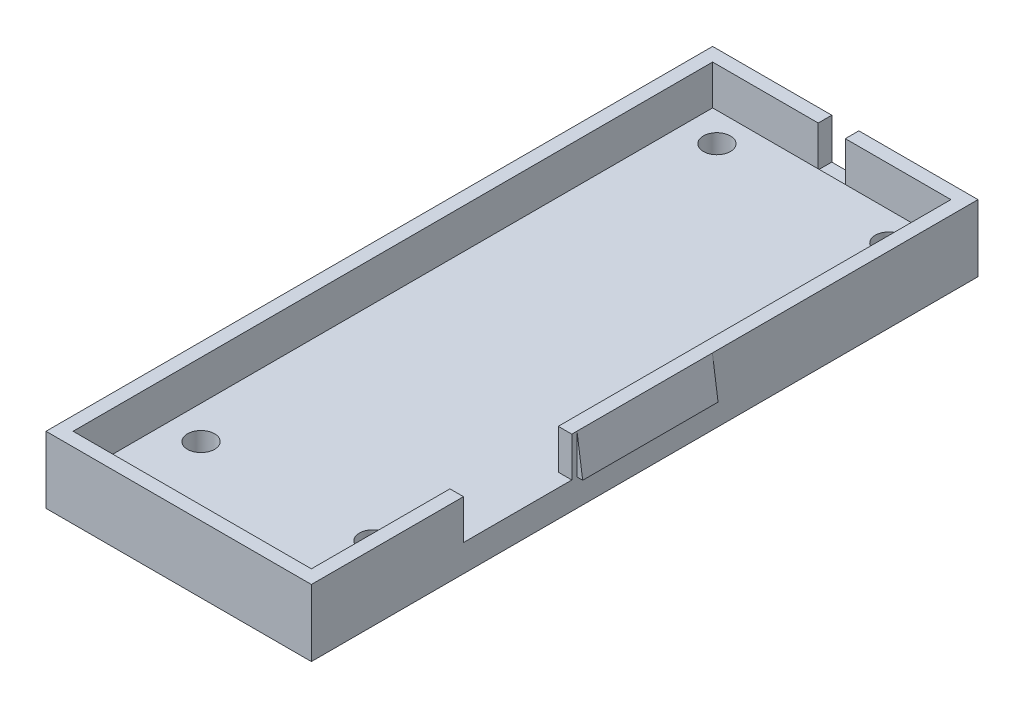
from build123d import *

# Parameters (mm, degrees)
SKETCH1_W               = 29.4
SKETCH1_H               = 73.85
SKETCH1_W_2             = 26.4
SKETCH1_H_2             = 70.85
SKETCH1_W_3             = 25.4
SKETCH1_H_3             = 69.85
BOSS_EXTRUDE1_DEPTH     = 3
SKETCH1_3_W             = 29.4
SKETCH1_3_H             = 73.85
SKETCH1_3_W_2           = 26.4
SKETCH1_3_H_2           = 70.85
BOSS_EXTRUDE2_DEPTH     = 4.4
CUT_EXTRUDE1_DEPTH      = 40.986317973
CUT_EXTRUDE1_DEPTH_BACK = 40.986317973
SKETCH2_R               = 1.5
SKETCH3_W               = 3
SKETCH3_H               = 4.5
CUT_EXTRUDE2_DEPTH      = 1.5
SKETCH4_W               = 12
SKETCH4_H               = 4.4
CUT_EXTRUDE3_DEPTH      = 1.5
SKETCH5_W               = 15
SKETCH5_H               = 4.4
BOSS_EXTRUDE3_DEPTH     = 1
CHAMFER1_SIZE           = 1
CHAMFER1_SIZE_2         = 7
CHAMFER2_SIZE           = 1
CHAMFER2_SIZE_2         = 7


with BuildPart() as part:
    # Sketch1 → Boss-Extrude1 (new body)
    # profile 1 of 3: a face of its own
    with BuildSketch(Plane(origin=(0, 0, 0), x_dir=(1, 0, 0), z_dir=(0, 1, 0))):
        Rectangle(SKETCH1_W, SKETCH1_H)
        Rectangle(SKETCH1_W_2, SKETCH1_H_2, mode=Mode.SUBTRACT)
    # profile 2 of 3: a face of its own
    with BuildSketch(Plane(origin=(0, 0, 0), x_dir=(1, 0, 0), z_dir=(0, 1, 0))):
        Rectangle(SKETCH1_W_2, SKETCH1_H_2)
        Rectangle(SKETCH1_W_3, SKETCH1_H_3, mode=Mode.SUBTRACT)
    # profile 3 of 3: a face of its own
    with BuildSketch(Plane(origin=(0, 0, 0), x_dir=(1, 0, 0), z_dir=(0, 1, 0))):
        Rectangle(SKETCH1_W_3, SKETCH1_H_3)
    extrude(amount=-BOSS_EXTRUDE1_DEPTH)

    # Sketch1<3> → Boss-Extrude2 (add)
    with BuildSketch(Plane(origin=(0, 0, 0), x_dir=(1, 0, 0), z_dir=(0, 1, 0))):
        Rectangle(SKETCH1_3_W, SKETCH1_3_H)
        Rectangle(SKETCH1_3_W_2, SKETCH1_3_H_2, mode=Mode.SUBTRACT)
    extrude(amount=BOSS_EXTRUDE2_DEPTH)

    # Sketch2 → Cut-Extrude1 (cut, two sides: drawn at the far end of the back side and taken through both)
    with BuildSketch(Plane(origin=(0, 0, 0), x_dir=(1, 0, 0), z_dir=(0, 1, 0)).offset(-CUT_EXTRUDE1_DEPTH_BACK)):
        with BuildLine():
            ThreePointArc((11.025, 32.225), (9.525, 33.725), (8.025, 32.225))
            Line((8.025, 32.225), (9.525, 32.225))
            Line((9.525, 32.225), (9.525, 30.725))
            ThreePointArc((9.525, 30.725), (10.585660172, 31.164339828), (11.025, 32.225))
        make_face()
        with BuildLine():
            Line((9.525, 32.225), (8.025, 32.225))
            ThreePointArc((8.025, 32.225), (8.464339828, 31.164339828), (9.525, 30.725))
            Line((9.525, 30.725), (9.525, 32.225))
        make_face()
        with Locations(Location((-9.525, 32.225, 0), (0, 0, 270))):
            Circle(SKETCH2_R)
        with Locations(Location((-9.525, -24.925, 0), (0, 0, 270))):
            Circle(SKETCH2_R)
        with Locations(Location((9.525, -24.925, 0), (0, 0, 270))):
            Circle(SKETCH2_R)
    extrude(amount=CUT_EXTRUDE1_DEPTH + CUT_EXTRUDE1_DEPTH_BACK, mode=Mode.SUBTRACT)

    # Sketch3 → Cut-Extrude2 (cut)
    with BuildSketch(Plane(origin=(0, 0, -36.925), x_dir=(-1, 0, 0), z_dir=(0, 0, -1))):
        with Locations((0, 2.15)):
            Rectangle(SKETCH3_W, SKETCH3_H)
    extrude(amount=-CUT_EXTRUDE2_DEPTH, mode=Mode.SUBTRACT)

    # Sketch4 → Cut-Extrude3 (cut)
    with BuildSketch(Plane.ZY.offset(-13.2)):
        with Locations((14.075, 2.2)):
            Rectangle(SKETCH4_W, SKETCH4_H)
    extrude(amount=-CUT_EXTRUDE3_DEPTH, mode=Mode.SUBTRACT)

    # Sketch5 → Boss-Extrude3 (add)
    with BuildSketch(Plane.ZY.offset(14.7)):
        with Locations((0, 2.2)):
            Rectangle(SKETCH5_W, SKETCH5_H)
    boss_extrude3 = extrude(amount=BOSS_EXTRUDE3_DEPTH)

    # Chamfer1
    # the kernel refuses this chamfer: 7, 1 mm, written as the material it takes off along each edge
    with BuildSketch(Plane(origin=(-15.7, 4.4, -25.693233978), x_dir=(0.9662442572155542, 0.2576277069687226, 0), z_dir=(0, 0, 1))) as chamfer1_piece_1:
        Polygon((CHAMFER1_SIZE * 0.966244257216, -CHAMFER1_SIZE * 0.257627706969), (-CHAMFER1_SIZE_2 * 0.257627706969, -CHAMFER1_SIZE_2 * 0.966244257216), (0, 0), align=None)
    extrude(amount=51.386467957, mode=Mode.SUBTRACT)

    # Mirror1: Boss-Extrude3 across plane
    add(boss_extrude3.mirror(Plane(origin=(0, 0, 0), x_dir=(0, 0, 1), z_dir=(1, 0, 0))))

    # Chamfer2
    # the kernel refuses this chamfer: 7, 1 mm, written as the material it takes off along each edge
    with BuildSketch(Plane(origin=(15.7, 4.4, -25.693233978), x_dir=(-0.9662442572155542, 0.2576277069687226, 0), z_dir=(0, 0, 1))) as chamfer2_piece_1:
        Polygon((CHAMFER2_SIZE * 0.966244257216, CHAMFER2_SIZE * 0.257627706969), (-CHAMFER2_SIZE_2 * 0.257627706969, CHAMFER2_SIZE_2 * 0.966244257216), (0, 0), align=None)
    extrude(amount=51.386467957, mode=Mode.SUBTRACT)


solid = part.part
